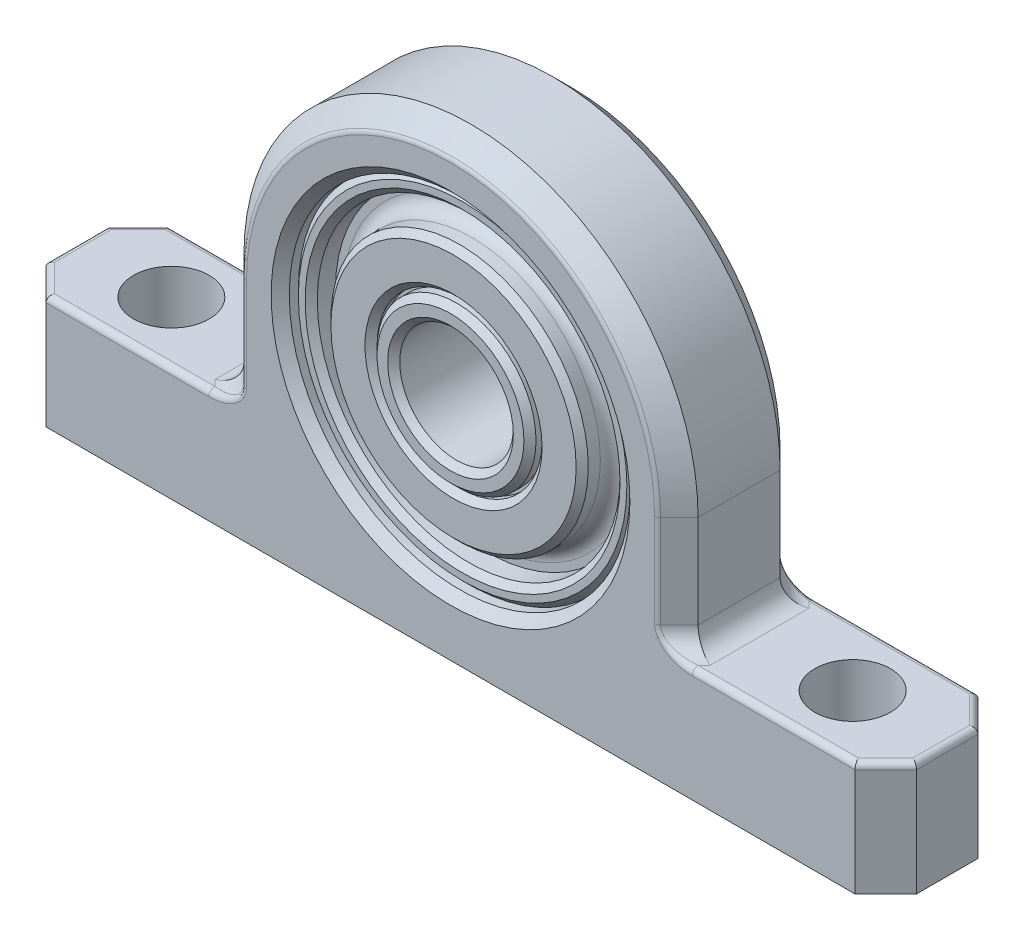
from build123d import *

# Parameters (mm, degrees)
EXTRUDE1_DEPTH      = 2.579687
EXTRUDE1_DEPTH_BACK = 2.579687
SKETCH3_R           = 7.14375
SKETCH4_R           = 1.5875
CUT_EXTRUDE1_DEPTH  = 24.325481888
CHAMFER3_SIZE       = 0.859895833
FILLET6_R           = 0.859895833
FILLET7_R           = 0.254
CHAMFER4_SIZE       = 0.381
CHAMFER5_SIZE       = 0.254
FILLET8_R           = 0.635


with BuildPart() as part:
    # Sketch3 → Extrude1 (new, two sides: drawn at the far end of the back side and taken through both)
    with BuildSketch(Plane.XY.offset(-EXTRUDE1_DEPTH_BACK)):
        with BuildLine():
            Line((9.525, 0), (9.525, -4.7625))
            Line((9.525, -4.7625), (18.25625, -4.7625))
            Line((18.25625, -4.7625), (18.25625, -9.525))
            Line((18.25625, -9.525), (-18.25625, -9.525))
            Line((-18.25625, -9.525), (-18.25625, -4.7625))
            Line((-18.25625, -4.7625), (-9.525, -4.7625))
            Line((-9.525, -4.7625), (-9.525, 0))
            ThreePointArc((-9.525, 0), (0, 9.525), (9.525, 0))
        make_face()
        Circle(SKETCH3_R, mode=Mode.SUBTRACT)
    extrude(amount=EXTRUDE1_DEPTH + EXTRUDE1_DEPTH_BACK)

    # Sketch4 → Cut-Extrude1 (cut, through all)
    with BuildSketch(Plane(origin=(0, -4.7625, 0), x_dir=(1, 0, 0), z_dir=(0, 1, 0))):
        with Locations(Location((-14.2875, 0, 0), (0, 0, 270))):
            Circle(SKETCH4_R)
        with Locations(Location((14.2875, 0, 0), (0, 0, 270))):
            Circle(SKETCH4_R)
        Polygon((-18.25625, 2.5796875), (-18.25625, 1.28984375), (-16.96640625, 2.5796875), align=None)
        Polygon((16.96640625, 2.5796875), (18.25625, 2.5796875), (18.25625, 1.28984375), align=None)
        Polygon((18.25625, -2.5796875), (18.25625, -1.28984375), (16.96640625, -2.5796875), align=None)
        Polygon((-16.96640625, -2.5796875), (-18.25625, -2.5796875), (-18.25625, -1.28984375), align=None)
    extrude(amount=-CUT_EXTRUDE1_DEPTH, mode=Mode.SUBTRACT)

    # Chamfer3
    chamfer3_edges = [part.edges().sort_by_distance(p)[0] for p in [
        (0, 9.525, -2.579687),
        (9.525, -2.38125, -2.579687),
        (9.525, -2.38125, 2.579687),
        (-9.525, -2.38125, -2.579687),
        (0, 9.525, 2.579687),
        (-9.525, -2.38125, 2.579687),
    ]]
    chamfer(chamfer3_edges, length=CHAMFER3_SIZE)

    # Fillet6
    fillet6_edges = [part.edges().sort_by_distance(p)[0] for p in [
        (9.525, -4.7625, 0),
        (-9.095052083, -4.7625, -2.149739083),
        (9.095052083, -4.7625, -2.149739083),
        (-9.095052083, -4.7625, 2.149739083),
        (9.095052083, -4.7625, 2.149739083),
        (-9.525, -4.7625, 0),
    ]]
    fillet(fillet6_edges, radius=FILLET6_R)

    # Fillet7
    fillet7_edges = [part.edges().sort_by_distance(p)[0] for p in [
        (8.665104167, -1.951302083, -2.579687),
        (0, 8.665104167, -2.579687),
        (0, 8.665104167, 2.579687),
        (-8.665104167, -1.951302083, 2.579687),
        (-13.423793633, -4.7625, 2.579687),
        (-13.423793633, -4.7625, -2.579687),
        (-8.665104167, -1.951302083, -2.579687),
        (8.665104167, -1.951302083, 2.579687),
        (-9.095535719, -4.558959231, -2.579687),
        (-9.095535719, -4.558959231, 2.579687),
        (9.095535719, -4.558959231, -2.579687),
        (9.095535719, -4.558959231, 2.579687),
        (-17.611328375, -4.7625, -1.934765375),
        (13.423793633, -4.7625, -2.579687),
        (17.611328375, -4.7625, -1.934765375),
        (18.25625, -4.7625, 0),
        (13.423793633, -4.7625, 2.579687),
        (17.611328375, -4.7625, 1.934765375),
        (-18.25625, -4.7625, 0),
        (-17.611328375, -4.7625, 1.934765375),
    ]]
    fillet(fillet7_edges, radius=FILLET7_R)

    # Chamfer4
    chamfer4_edges = [part.edges().sort_by_distance(p)[0] for p in [
        (-7.14375, 0, 2.579687),
        (-7.14375, 0, -2.579687),
    ]]
    chamfer(chamfer4_edges, length=CHAMFER4_SIZE)


with BuildPart() as body_2:
    # Sketch5 → Revolve1 (revolve)
    with BuildSketch(Plane(origin=(0, 0, 0), x_dir=(0, 0, -1), z_dir=(1, 0, 0)), mode=Mode.PRIVATE) as revolve1_sk:
        Polygon((-2.0716875, 6.35), (-1.0556875, 6.35), (-1.0556875, 5.3975), (-2.4526875, 5.3975), (-2.4526875, 3.46075), (-1.9446875, 3.46075), (-1.9446875, 3.33375), (-2.5796875, 3.33375), (-2.5796875, 2.38125), (2.5796875, 2.38125), (2.5796875, 3.33375), (1.9446875, 3.33375), (1.9446875, 3.46075), (2.4526875, 3.46075), (2.4526875, 5.3975), (1.0556875, 5.3975), (1.0556875, 6.35), (2.0716875, 6.35), (2.0716875, 7.14375), (-2.0716875, 7.14375), align=None)
    revolve(revolve1_sk.sketch.rotate(Axis((0, 0, -2.5796875), (0, 0, 1)), 90), axis=Axis((0, 0, -2.5796875), (0, 0, 1)))

    # Chamfer5
    chamfer5_edges = [body_2.edges().sort_by_distance(p)[0] for p in [
        (5.3975, 0, 2.4526875),
        (3.46075, 0, 2.4526875),
        (3.33375, 0, 2.5796875),
        (2.38125, 0, 2.5796875),
        (2.38125, 0, -2.5796875),
        (3.33375, 0, -2.5796875),
        (3.46075, 0, -2.4526875),
        (5.3975, 0, -2.4526875),
        (6.35, 0, -2.0716875),
        (7.14375, 0, -2.0716875),
        (7.14375, 0, 2.0716875),
        (6.35, 0, 2.0716875),
    ]]
    chamfer(chamfer5_edges, length=CHAMFER5_SIZE)

    # Fillet8
    fillet8_edges = [body_2.edges().sort_by_distance(p)[0] for p in [
        (5.3975, 0, 1.0556875),
        (5.3975, 0, -1.0556875),
    ]]
    fillet(fillet8_edges, radius=FILLET8_R)


solid = Compound([part.part, body_2.part])
